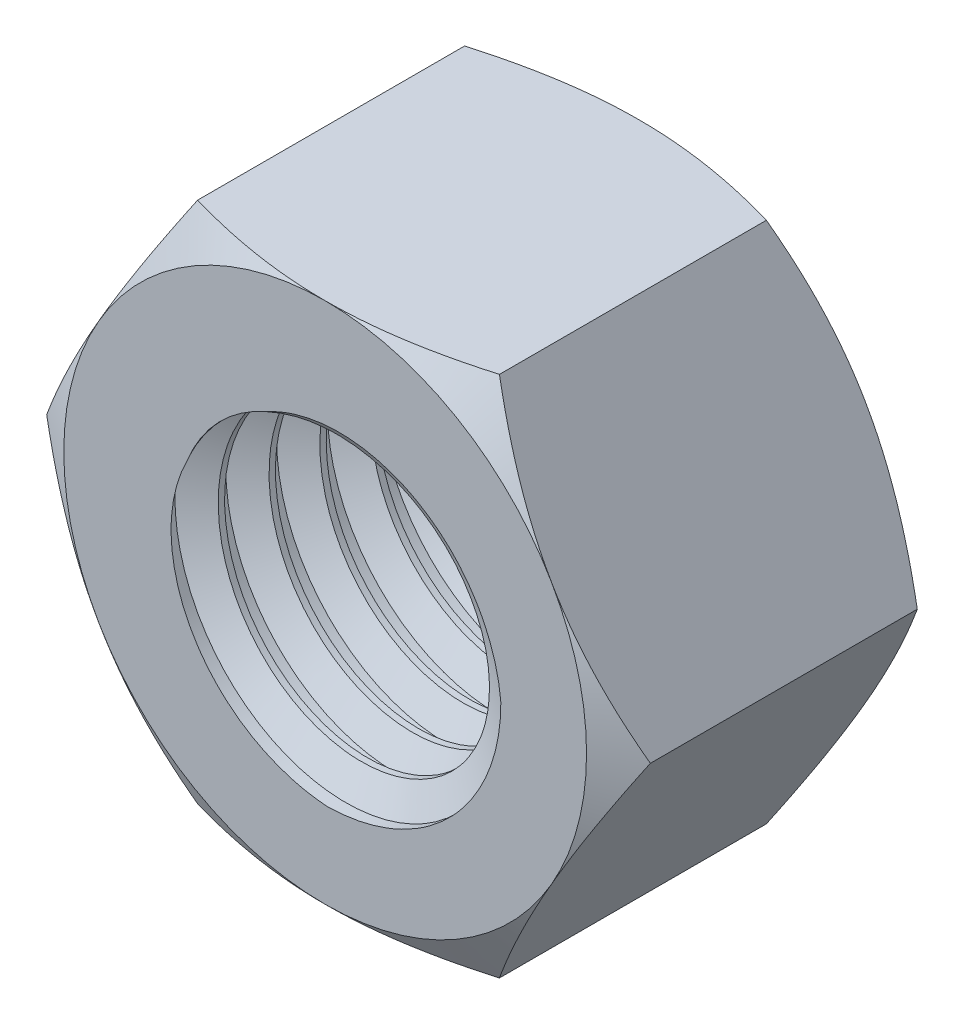
from build123d import *

# Parameters (mm, degrees)
BOSS_EXTRUDE1_DEPTH     = 10.8
M12X1_75_TAPPED_HOLE1_D = 10.2
THREAD1_PITCH           = 1.75


with BuildPart() as part:
    # Sketch1 → Boss-Extrude1 (new body)
    with BuildSketch(Plane.XY):
        Polygon((5.196152423, 9), (-5.196152423, 9), (-10.392304845, 0), (-5.196152423, -9), (5.196152423, -9), (10.392304845, 0), align=None)
    extrude(amount=BOSS_EXTRUDE1_DEPTH)

    # Sketch3 → Cut-Revolve1 (revolve, cut)
    with BuildSketch(Plane(origin=(0, 0, 0), x_dir=(0, 0, -1), z_dir=(1, 0, 0))):
        Polygon((0, 9), (0, 11.822639189), (-1.629651496, 11.822639189), align=None)
    cut_revolve1 = revolve(axis=Axis((0, 0, 0), (0, 0, -1)), mode=Mode.SUBTRACT)

    # Mirror1: Cut-Revolve1 across plane
    add(cut_revolve1.mirror(Plane(origin=(0, 0, 5.4), x_dir=(1, 0, 0), z_dir=(0, 0, -1))), mode=Mode.SUBTRACT)

    # M12x1.75 Tapped Hole1 (through all)
    with Locations(Plane(origin=(0, 0, 0), x_dir=(-1, 0, 0), z_dir=(0, 0, -1))):
        with Locations((0, 0)):
            Hole(M12X1_75_TAPPED_HOLE1_D / 2)

    # Thread1: the profile of Thread Profile1 profile screwed along a right-hand helix of 11.428571 turns, 10 arcs to a turn; built about Z, then put on its axis
    thread1_z = Axis((0, 0, 0), (0, 0, 1))
    thread1_corners = [(5.0997, 0, -0.000173205), (5.0997, 0, 1.5314232), (6.047215281, 0, 0.984374998), (6.047215281, 0, 0.546874998)]
    with BuildLine(mode=Mode.PRIVATE) as thread1_profile:
        Line(thread1_corners[0], thread1_corners[1])
        Line(thread1_corners[1], thread1_corners[2])
        Line(thread1_corners[2], thread1_corners[3])
        Line(thread1_corners[3], thread1_corners[0])
    thread1_cap = Face(thread1_profile.wire())
    thread1_turn_angles = [0, 18, 36, 54, 72, 90, 108, 126, 144, 162, 180, 198, 216, 234, 252, 270, 288, 306, 324, 342, 360]
    thread1_turn_weights = [1, 0.9510565162951535, 1, 0.9510565162951535, 1, 0.9510565162951535, 1, 0.9510565162951535, 1, 0.9510565162951535, 1, 0.9510565162951535, 1, 0.9510565162951535, 1, 0.9510565162951535, 1, 0.9510565162951535, 1, 0.9510565162951535, 1]
    thread1_turn_rails = [Edge.make_bspline([Vector(p[0], p[1], 0).rotate(thread1_z, thread1_turn_angles[k]) / thread1_turn_weights[k] + Vector(0, 0, p[2] + THREAD1_PITCH * thread1_turn_angles[k] / 360) for k in range(21)], [0, 0, 0, 1, 1, 2, 2, 3, 3, 4, 4, 5, 5, 6, 6, 7, 7, 8, 8, 9, 9, 10, 10, 10], 2, thread1_turn_weights) for p in thread1_corners]
    thread1_turn_sides = [Face.make_surface_from_curves(thread1_turn_rails[p[0]], thread1_turn_rails[p[1]]) for p in [(0, 1), (1, 2), (2, 3), (3, 0)]]
    thread1_last_angles = [3960, 3978, 3996, 4014, 4032, 4050, 4068, 4086, 4104, 4109.142857143, 4114.285714286]
    thread1_last_weights = [1, 0.9510565162951535, 1, 0.9510565162951535, 1, 0.9510565162951535, 1, 0.9510565162951535, 1, 0.9959742939952387, 1]
    thread1_last_rails = [Edge.make_bspline([Vector(p[0], p[1], 0).rotate(thread1_z, thread1_last_angles[k]) / thread1_last_weights[k] + Vector(0, 0, p[2] + THREAD1_PITCH * thread1_last_angles[k] / 360) for k in range(11)], [0, 0, 0, 1, 1, 2, 2, 3, 3, 4, 4, 5, 5, 5], 2, thread1_last_weights) for p in thread1_corners]
    thread1_last_sides = [Face.make_surface_from_curves(thread1_last_rails[p[0]], thread1_last_rails[p[1]]) for p in [(0, 1), (1, 2), (2, 3), (3, 0)]]
    thread1 = Plane(origin=(0, 0, -2), x_dir=(1, 0, 0), z_dir=(0, 0, 1)) * Solid(Shell([*[p.moved(Location((0, 0, THREAD1_PITCH * i))) for i in range(11) for p in thread1_turn_sides], *thread1_last_sides, thread1_cap, thread1_cap.rotate(thread1_z, 4114.285714286).moved(Location((0, 0, THREAD1_PITCH * 4114.285714286 / 360)))]))
    add(thread1, mode=Mode.SUBTRACT)


solid = part.part
